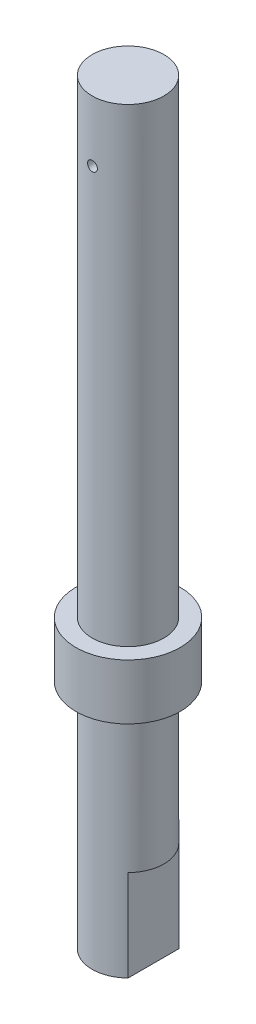
from build123d import *
from build123d.topology import SkipClean

# Parameters (mm, degrees)
SKETCH_1_R          = 2.75
EXTRUDE_1_DEPTH     = 51
EXTRUDE_START       = 7
EXTRUDE_2_DEPTH     = 7
EXTRUDE_START_2     = -22
SKETCH_3_R          = 4
EXTRUDE_3_DEPTH     = 4.25
SKETCH_4_R          = 0.375
CUT_EXTRUDE_1_DEPTH = 5


with BuildPart() as part:
    # 草图1 → 凸台-拉伸1 (new body)
    with BuildSketch(Plane(origin=(0, 0, 0), x_dir=(1, 0, 0), z_dir=(0, 1, 0))):
        Circle(SKETCH_1_R)
    extrude(amount=EXTRUDE_1_DEPTH)

    # 草图2 → 凸台-拉伸2 (add)
    with SkipClean():  # the faces are left unmerged after this step: merging them gives an invalid solid
        with BuildSketch(Plane.XZ.offset(EXTRUDE_START)):
            with BuildLine():
                Line((-1.95, 1.939071943), (-1.95, -1.939071943))
                ThreePointArc((-1.95, -1.939071943), (0, -2.75), (1.95, -1.939071943))
                Line((1.95, -1.939071943), (1.95, 1.939071943))
                ThreePointArc((1.95, 1.939071943), (0, 2.75), (-1.95, 1.939071943))
            make_face()
        extrude(amount=-EXTRUDE_2_DEPTH)

    # 草图3 → 凸台-拉伸3 (add)
    with SkipClean():  # the faces are left unmerged after this step: merging them gives an invalid solid
        with BuildSketch(Plane.XZ.offset(7).offset(EXTRUDE_START_2)):
            Circle(SKETCH_3_R)
        extrude(amount=EXTRUDE_3_DEPTH)

    # 草图4 → 切除-拉伸1 (cut, symmetric)
    with SkipClean():  # the faces are left unmerged after this step: merging them gives an invalid solid
        with BuildSketch(Plane.XY):
            with Locations((0, 46.345720238)):
                Circle(SKETCH_4_R)
        extrude(amount=CUT_EXTRUDE_1_DEPTH, both=True, mode=Mode.SUBTRACT)


solid = part.part
